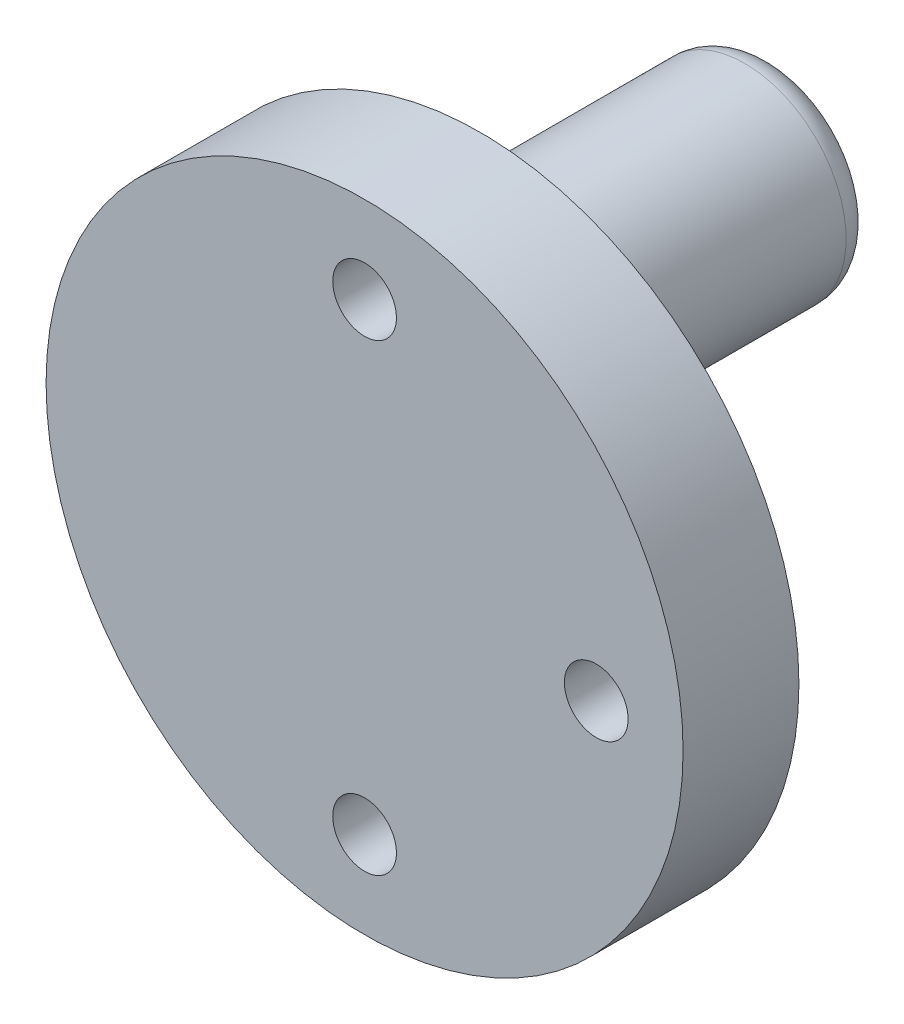
from build123d import *

# Parameters (mm, degrees)
SKETCH1_R                      = 11
SKETCH1_R_2                    = 1.05
BOSS_EXTRUDE1_DEPTH            = 4
SKETCH9_R                      = 6
BOSS_EXTRUDE2_DEPTH            = 15.13
SKETCH10_OUTSIDE_W             = 31.304
SKETCH10_OUTSIDE_H             = 31.304
SKETCH10_OUTSIDE_R             = 3.5
CUT_EXTRUDE2_DEPTH             = 15
FILLET1_R                      = 4.5
FILLET2_R                      = 1
FILLET4_R                      = 4
CBORE_FOR_M2_SHCS1_D           = 2.2
CBORE_FOR_M2_SHCS1_CBORE_D     = 4.4
CBORE_FOR_M2_SHCS1_CBORE_DEPTH = 2


with BuildPart() as part:
    # Sketch1 → Boss-Extrude1 (new body)
    with BuildSketch(Plane.XY):
        Circle(SKETCH1_R)
        with Locations((0, 8)):
            Circle(SKETCH1_R_2, mode=Mode.SUBTRACT)
        with Locations((8, 0)):
            Circle(SKETCH1_R_2, mode=Mode.SUBTRACT)
        with Locations((0, -8)):
            Circle(SKETCH1_R_2, mode=Mode.SUBTRACT)
    extrude(amount=BOSS_EXTRUDE1_DEPTH)

    # Sketch9 → Boss-Extrude2 (add)
    with BuildSketch(Plane(origin=(0, 0, 0), x_dir=(-1, 0, 0), z_dir=(0, 0, -1))):
        with Locations((5, 0)):
            Circle(SKETCH9_R)
    extrude(amount=BOSS_EXTRUDE2_DEPTH)

    # Sketch10 outside → Cut-Extrude2 (cut)
    with BuildSketch(Plane(origin=(0, 0, -15.13), x_dir=(-1, 0, 0), z_dir=(0, 0, -1))):
        Rectangle(SKETCH10_OUTSIDE_W, SKETCH10_OUTSIDE_H)
        with Locations((5, 0)):
            Circle(SKETCH10_OUTSIDE_R, mode=Mode.SUBTRACT)
    extrude(amount=-CUT_EXTRUDE2_DEPTH, mode=Mode.SUBTRACT)

    # Fillet1
    # the kernel refuses this fillet: 4.5 mm, written as the material it adds along each edge
    with BuildSketch(Plane(origin=(-5, 0, 0), x_dir=(-1, 0, 0), z_dir=(0, -1, 0))) as fillet1_piece_1_section:
        with BuildLine():
            CenterArc((7.073824939, 4.5), FILLET1_R, 256.19443595, 13.80556405)
            Line((6, 0.13), (6, 0))
            Line((6, 0), (7.073824939, 0))
        make_face()
    fillet1_piece_1 = revolve(axis=Axis((-5, 0, 0), (0, 0, -1)), mode=Mode.PRIVATE)
    fillet1_piece_1 = fillet1_piece_1 & Plane(origin=(0, 0, -0.023683453), x_dir=(1, 0, 0), z_dir=(0, 0, -1)) * Cylinder(11, 29, mode=Mode.PRIVATE)
    add(fillet1_piece_1)

    # Fillet2
    fillet2_edges = [part.edges().sort_by_distance(p)[0] for p in [
        (-1.5, 0, -15.13),
    ]]
    fillet(fillet2_edges, radius=FILLET2_R)

    # Fillet4
    # the kernel refuses this fillet: 4 mm, written as the material it adds along each edge
    with BuildSketch(Plane(origin=(-5, 0, -0.13), x_dir=(-1, 0, 0), z_dir=(0, -1, 0))) as fillet4_piece_1:
        with BuildLine():
            CenterArc((7.5, 3.708099244), FILLET4_R, 180, 67.975687163)
            Line((6, 0), (5.97, -0.074161985))
            ThreePointArc((5.97, -0.074161985), (4.75, -0.08), (3.5, -0.08))
            Line((3.5, -0.08), (3.42, 0))
            Line((3.42, 0), (3.42, 3.708099244))
            Line((3.42, 3.708099244), (3.5, 3.708099244))
        make_face()
    revolve(axis=Axis((-5, 0, -0.13), (0, 0, -1)))

    # CBORE for M2 SHCS1 (through all)
    with Locations(Plane(origin=(0, 0, 0), x_dir=(-1, 0, 0), z_dir=(0, 0, -1))):
        with Locations((0, 8), (-8, 0), (0, -8)):
            CounterBoreHole(CBORE_FOR_M2_SHCS1_D / 2, CBORE_FOR_M2_SHCS1_CBORE_D / 2, CBORE_FOR_M2_SHCS1_CBORE_DEPTH)


solid = part.part
